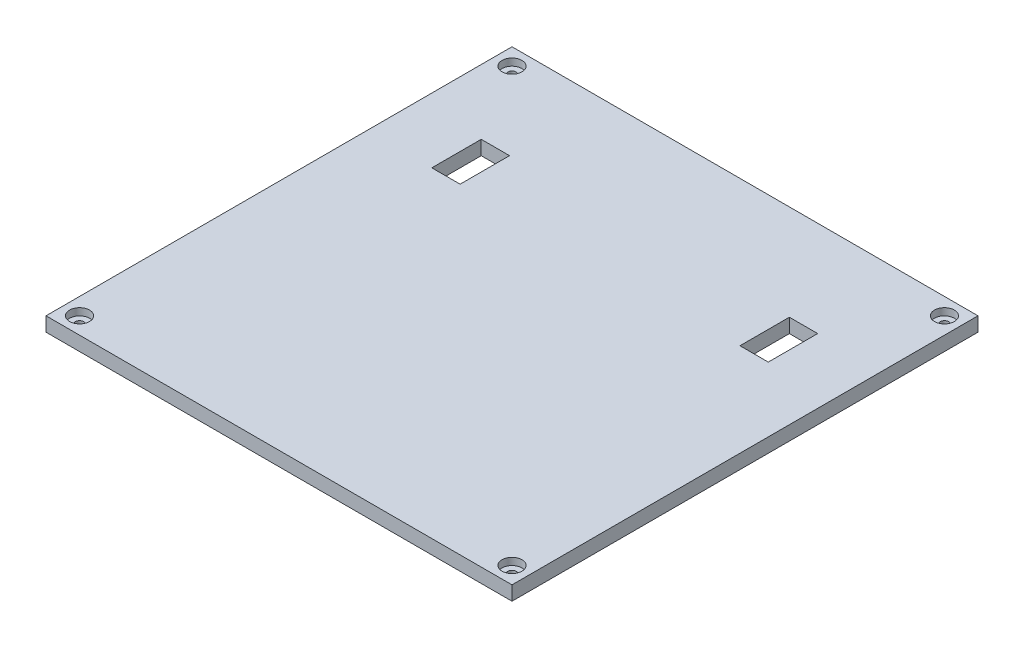
from build123d import *

# Parameters (mm, degrees)
SKETCH1_W                                  = 416.08
SKETCH1_H                                  = 416.08
BOSS_EXTRUDE1_DEPTH                        = 12.7
SKETCH2_R                                  = 3.683
CUT_EXTRUDE1_DEPTH                         = 589.563015148
SKETCH3_R                                  = 8.89
CUT_EXTRUDE2_DEPTH                         = 6.35
MIRROR1_AT_THE_SECOND_PLANE_COPY_1_SKETC_R = 3.683
MIRROR1_AT_THE_SECOND_PLANE_COPY_1_DEPTH   = 589.563015148
MIRROR1_AT_THE_SECOND_PLANE_COPY_2_SKETC_R = 8.89
MIRROR1_AT_THE_SECOND_PLANE_COPY_2_DEPTH   = 6.35
SKETCH4_W                                  = 25.273063745
SKETCH4_H                                  = 44.120772301
CUT_EXTRUDE3_DEPTH                         = 589.563015148


with BuildPart() as part:
    # Sketch1 → Boss-Extrude1 (new body)
    with BuildSketch(Plane(origin=(0, 0, 0), x_dir=(1, 0, 0), z_dir=(0, 1, 0))):
        with Locations((208.04, 208.04)):
            Rectangle(SKETCH1_W, SKETCH1_H)
    extrude(amount=BOSS_EXTRUDE1_DEPTH)

    # Sketch2 → Cut-Extrude1 (cut, through all)
    with BuildSketch(Plane(origin=(0, 12.7, 0), x_dir=(1, 0, 0), z_dir=(0, 1, 0))):
        with Locations((14.986, 14.986)):
            Circle(SKETCH2_R)
    cut_extrude1 = extrude(amount=-CUT_EXTRUDE1_DEPTH, mode=Mode.SUBTRACT)

    # Sketch3 → Cut-Extrude2 (cut, symmetric)
    with BuildSketch(Plane(origin=(0, 12.7, 0), x_dir=(1, 0, 0), z_dir=(0, 1, 0))):
        with Locations((14.986, 14.986)):
            Circle(SKETCH3_R)
    cut_extrude2 = extrude(amount=CUT_EXTRUDE2_DEPTH, both=True, mode=Mode.SUBTRACT)

    # Mirror1: Cut-Extrude1, Cut-Extrude2 across plane
    add(cut_extrude1.mirror(Plane(origin=(0, 0, -208.04), x_dir=(1, 0, 0), z_dir=(0, 0, -1))), mode=Mode.SUBTRACT)
    add(cut_extrude2.mirror(Plane(origin=(0, 0, -208.04), x_dir=(1, 0, 0), z_dir=(0, 0, -1))), mode=Mode.SUBTRACT)

    # Mirror1 at the second plane: Cut-Extrude1, Cut-Extrude2 across plane
    add(cut_extrude1.mirror(Plane.ZY.offset(-208.04)), mode=Mode.SUBTRACT)
    add(cut_extrude2.mirror(Plane.ZY.offset(-208.04)), mode=Mode.SUBTRACT)

    # Mirror1 at the second plane copy 1 sketc → Mirror1 at the second plane copy 1 (cut, through all)
    with BuildSketch(Plane(origin=(416.08, 12.7, -416.08), x_dir=(-1, 0, 0), z_dir=(0, 1, 0))):
        with Locations((14.986, 14.986)):
            Circle(MIRROR1_AT_THE_SECOND_PLANE_COPY_1_SKETC_R)
    extrude(amount=-MIRROR1_AT_THE_SECOND_PLANE_COPY_1_DEPTH, mode=Mode.SUBTRACT)

    # Mirror1 at the second plane copy 2 sketc → Mirror1 at the second plane copy 2 (cut, symmetric)
    with BuildSketch(Plane(origin=(416.08, 12.7, -416.08), x_dir=(-1, 0, 0), z_dir=(0, 1, 0))):
        with Locations((14.986, 14.986)):
            Circle(MIRROR1_AT_THE_SECOND_PLANE_COPY_2_SKETC_R)
    extrude(amount=MIRROR1_AT_THE_SECOND_PLANE_COPY_2_DEPTH, both=True, mode=Mode.SUBTRACT)

    # Sketch4 → Cut-Extrude3 (cut, through all)
    with BuildSketch(Plane.XZ):
        with Locations((70.470342559, -308.705083916)):
            Rectangle(SKETCH4_W, SKETCH4_H)
        with Locations((345.609657442, -308.705083916)):
            Rectangle(SKETCH4_W, SKETCH4_H)
    extrude(amount=-CUT_EXTRUDE3_DEPTH, mode=Mode.SUBTRACT)


solid = part.part
